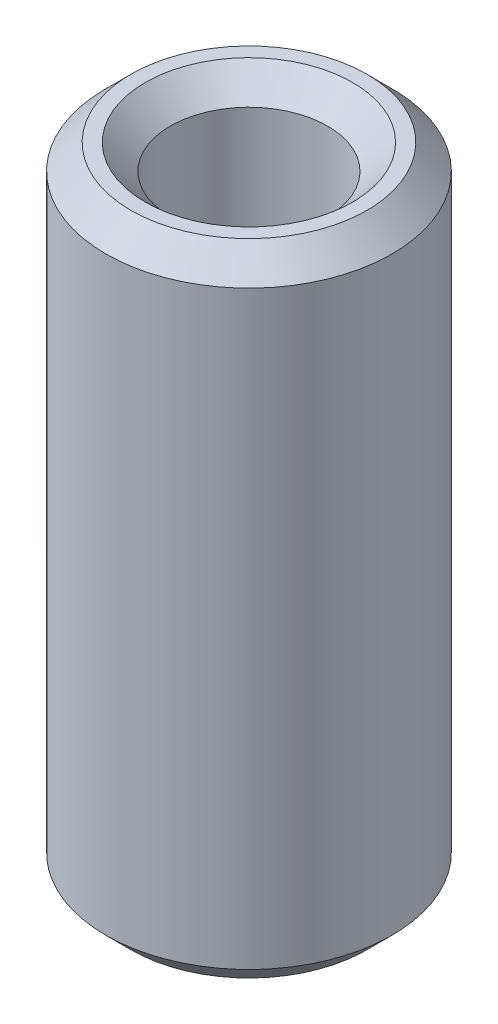
from build123d import *

# Parameters (mm, degrees)
SKETCH1_R           = 22.5
BOSS_EXTRUDE1_DEPTH = 100.664642714
SKETCH2_R           = 12.348554241
CUT_EXTRUDE1_DEPTH  = 106.574003868
CHAMFER1_SIZE       = 3.951736695


with BuildPart() as part:
    # Sketch1 → Boss-Extrude1 (new body)
    with BuildSketch(Plane(origin=(0, 0, 0), x_dir=(1, 0, 0), z_dir=(0, 1, 0))):
        Circle(SKETCH1_R)
    extrude(amount=BOSS_EXTRUDE1_DEPTH)

    # Sketch2 → Cut-Extrude1 (cut, through all)
    with BuildSketch(Plane(origin=(0, 0, 0), x_dir=(1, 0, 0), z_dir=(0, 1, 0))):
        Circle(SKETCH2_R)
    extrude(amount=CUT_EXTRUDE1_DEPTH, mode=Mode.SUBTRACT)

    # Chamfer1
    chamfer1_edges = [part.edges().sort_by_distance(p)[0] for p in [
        (-12.348554241, 100.664642714, 0),
        (-12.348554241, 0, 0),
        (-22.5, 0, 0),
        (-22.5, 100.664642714, 0),
    ]]
    chamfer(chamfer1_edges, length=CHAMFER1_SIZE)


solid = part.part
